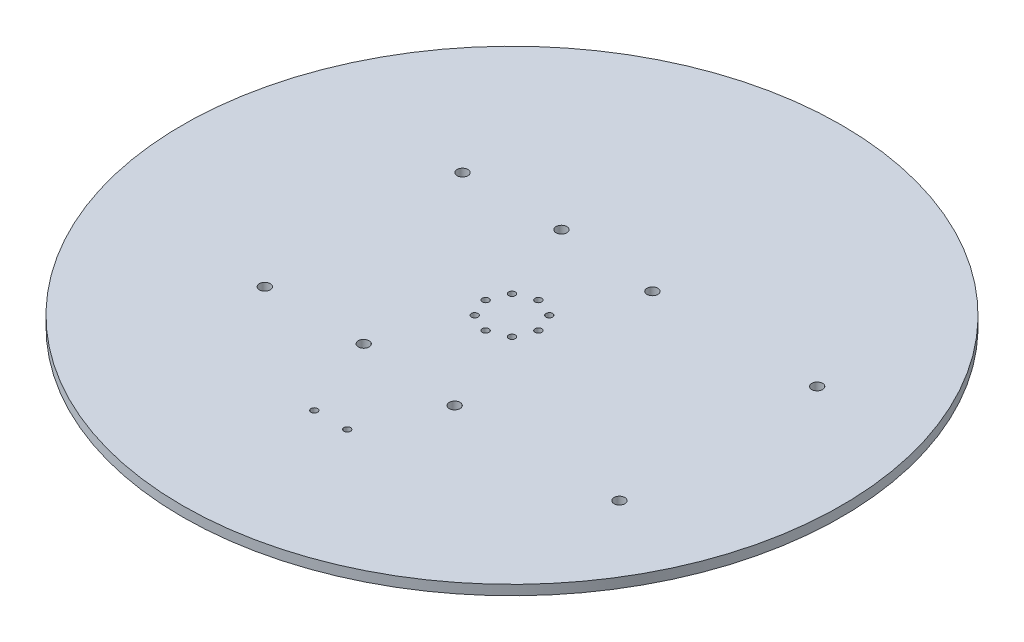
from build123d import *

# Parameters (mm, degrees)
SKETCH2_R                   = 100
BOSS_EXTRUDE1_DEPTH         = 3
SKETCH3_R                   = 7.5
BOSS_EXTRUDE2_DEPTH         = 4.75
CIRPATTERN1_COUNT           = 5
FILLET3_R                   = 8
SKETCH5_R                   = 1
CUT_EXTRUDE1_DEPTH          = 3
BOSS_EXTRUDE3_DEPTH         = 3
TAP_DRILL_FOR_M4X0_7_TAP1_D = 3.3
TAP_DRILL_FOR_M4X0_7_TAP2_D = 3.3
SKETCH10_R                  = 1
CUT_EXTRUDE2_DEPTH          = 142.633550056


with BuildPart() as part:
    # Sketch2 → Boss-Extrude1 (new body)
    with BuildSketch(Plane(origin=(0, 0, 0), x_dir=(1, 0, 0), z_dir=(0, 1, 0))):
        with Locations(Location((0, 0, 0), (0, 0, 270))):
            Circle(SKETCH2_R)
    extrude(amount=BOSS_EXTRUDE1_DEPTH)

    # Sketch3 → Boss-Extrude2 (add)
    with BuildSketch(Plane.XZ):
        with Locations(Location((0, 75, 0), (0, 0, 90))):
            Circle(SKETCH3_R)
    boss_extrude2 = extrude(amount=BOSS_EXTRUDE2_DEPTH)

    # CirPattern1: Boss-Extrude2 ×5 about axis
    cirpattern1_axis = Axis((0, 0, 0), (0, 1, 0))
    for i in range(1, CIRPATTERN1_COUNT):
        add(boss_extrude2.rotate(cirpattern1_axis, i * 360 / CIRPATTERN1_COUNT))

    # Fillet3
    # the kernel refuses this fillet: 8 mm, written as the material it takes off along each edge
    with BuildSketch(Plane(origin=(-71.329238722, -4.75, 23.176274578), x_dir=(-0.9510565162951535, 0, 0.30901699437494723), z_dir=(0.30901699437494723, 0, 0.9510565162951535))) as fillet3_piece_1:
        with BuildLine():
            CenterArc((0.189904241, -8), FILLET3_R, 23.969482318, 66.030517682)
            Line((0.189904241, 0), (0.189904241, 0.16))
            Line((0.189904241, 0.16), (7.5, 0.16))
            Line((7.5, 0.16), (7.66, 0))
            ThreePointArc((7.66, 0), (7.66, -2.375), (7.646201915, -4.685))
            Line((7.646201915, -4.685), (7.5, -4.75))
        make_face()
    revolve(axis=Axis((-71.329238722, -4.75, 23.176274578), (0, -1, 0)), mode=Mode.SUBTRACT)
    with BuildSketch(Plane(origin=(-44.083893922, -4.75, -60.676274578), x_dir=(-0.5877852522924734, 0, -0.8090169943749472), z_dir=(-0.8090169943749472, 0, 0.5877852522924734))) as fillet3_piece_2:
        with BuildLine():
            CenterArc((0.189904241, -8), FILLET3_R, 23.969482318, 66.030517682)
            Line((0.189904241, 0), (0.189904241, 0.16))
            Line((0.189904241, 0.16), (7.5, 0.16))
            Line((7.5, 0.16), (7.66, 0))
            ThreePointArc((7.66, 0), (7.66, -2.375), (7.646201915, -4.685))
            Line((7.646201915, -4.685), (7.5, -4.75))
        make_face()
    revolve(axis=Axis((-44.083893922, -4.75, -60.676274578), (0, -1, 0)), mode=Mode.SUBTRACT)
    with BuildSketch(Plane(origin=(44.083893922, -4.75, -60.676274578), x_dir=(0.5877852522924734, 0, -0.8090169943749472), z_dir=(-0.8090169943749472, 0, -0.5877852522924734))) as fillet3_piece_3:
        with BuildLine():
            CenterArc((0.189904241, -8), FILLET3_R, 23.969482318, 66.030517682)
            Line((0.189904241, 0), (0.189904241, 0.16))
            Line((0.189904241, 0.16), (7.5, 0.16))
            Line((7.5, 0.16), (7.66, 0))
            ThreePointArc((7.66, 0), (7.66, -2.375), (7.646201915, -4.685))
            Line((7.646201915, -4.685), (7.5, -4.75))
        make_face()
    revolve(axis=Axis((44.083893922, -4.75, -60.676274578), (0, -1, 0)), mode=Mode.SUBTRACT)
    with BuildSketch(Plane(origin=(71.329238722, -4.75, 23.176274578), x_dir=(0.9510565162951535, 0, 0.30901699437494723), z_dir=(0.30901699437494723, 0, -0.9510565162951535))) as fillet3_piece_4:
        with BuildLine():
            CenterArc((0.189904241, -8), FILLET3_R, 23.969482318, 66.030517682)
            Line((0.189904241, 0), (0.189904241, 0.16))
            Line((0.189904241, 0.16), (7.5, 0.16))
            Line((7.5, 0.16), (7.66, 0))
            ThreePointArc((7.66, 0), (7.66, -2.375), (7.646201915, -4.685))
            Line((7.646201915, -4.685), (7.5, -4.75))
        make_face()
    revolve(axis=Axis((71.329238722, -4.75, 23.176274578), (0, -1, 0)), mode=Mode.SUBTRACT)
    with BuildSketch(Plane(origin=(0, -4.75, 75), x_dir=(0, 0, 1), z_dir=(1, 0, 0))) as fillet3_piece_5:
        with BuildLine():
            CenterArc((0.189904241, -8), FILLET3_R, 23.969482318, 66.030517682)
            Line((0.189904241, 0), (0.189904241, 0.16))
            Line((0.189904241, 0.16), (7.5, 0.16))
            Line((7.5, 0.16), (7.66, 0))
            ThreePointArc((7.66, 0), (7.66, -2.375), (7.646201915, -4.685))
            Line((7.646201915, -4.685), (7.5, -4.75))
        make_face()
    revolve(axis=Axis((0, -4.75, 75), (0, -1, 0)), mode=Mode.SUBTRACT)

    # Sketch5 → Cut-Extrude1 (cut)
    with BuildSketch(Plane.XZ):
        with Locations(Location((0, 8, 0), (0, 0, 270))):
            Circle(SKETCH5_R)
        with Locations(Location((5.656854249, 5.656854249, 0), (0, 0, 270))):
            Circle(SKETCH5_R)
        with Locations(Location((8, 0, 0), (0, 0, 270))):
            Circle(SKETCH5_R)
        with Locations(Location((5.656854249, -5.656854249, 0), (0, 0, 270))):
            Circle(SKETCH5_R)
        with Locations(Location((0, -8, 0), (0, 0, 270))):
            Circle(SKETCH5_R)
        with Locations(Location((-5.656854249, -5.656854249, 0), (0, 0, 270))):
            Circle(SKETCH5_R)
        with Locations(Location((-8, 0, 0), (0, 0, 270))):
            Circle(SKETCH5_R)
        with Locations(Location((-5.656854249, 5.656854249, 0), (0, 0, 270))):
            Circle(SKETCH5_R)
    extrude(amount=-CUT_EXTRUDE1_DEPTH, mode=Mode.SUBTRACT)

    # Sketch5<3> → Boss-Extrude3 (add)
    with BuildSketch(Plane.XZ):
        with BuildLine():
            Line((0.75, -9.5), (-0.75, -9.5))
            Line((-0.75, -9.5), (-0.75, -10.974402034))
            ThreePointArc((-0.75, -10.974402034), (0, -11), (0.75, -10.974402034))
            Line((0.75, -10.974402034), (0.75, -9.5))
        make_face()
        with BuildLine():
            ThreePointArc((0.75, -10.974402034), (0, -11), (-0.75, -10.974402034))
            Line((-0.75, -10.974402034), (-0.75, -12.5))
            Line((-0.75, -12.5), (0.75, -12.5))
            Line((0.75, -12.5), (0.75, -10.974402034))
        make_face()
    extrude(amount=BOSS_EXTRUDE3_DEPTH)

    # Tap Drill for M4x0.7 Tap1 (through all)
    with Locations(Plane(origin=(-45, 3, -30), x_dir=(0, 0, 1), z_dir=(0, 1, 0))):
        with Locations((0, 0), (0, 30), (60, 0), (60, 30)):
            Hole(TAP_DRILL_FOR_M4X0_7_TAP1_D / 2)

    # Tap Drill for M4x0.7 Tap2 (through all)
    with Locations(Plane(origin=(15, 3, -27.6), x_dir=(0, 0, 1), z_dir=(0, 1, 0))):
        with Locations((0, 0), (60, 0), (60, 50), (0, 50)):
            Hole(TAP_DRILL_FOR_M4X0_7_TAP2_D / 2)

    # Sketch10 → Cut-Extrude2 (cut, through all)
    with BuildSketch(Plane(origin=(0, 3, 0), x_dir=(1, 0, 0), z_dir=(0, 1, 0))):
        with Locations(Location((5, -55, 0), (0, 0, 270))):
            Circle(SKETCH10_R)
        with Locations(Location((-5, -55, 0), (0, 0, 270))):
            Circle(SKETCH10_R)
    extrude(amount=-CUT_EXTRUDE2_DEPTH, mode=Mode.SUBTRACT)


solid = part.part
